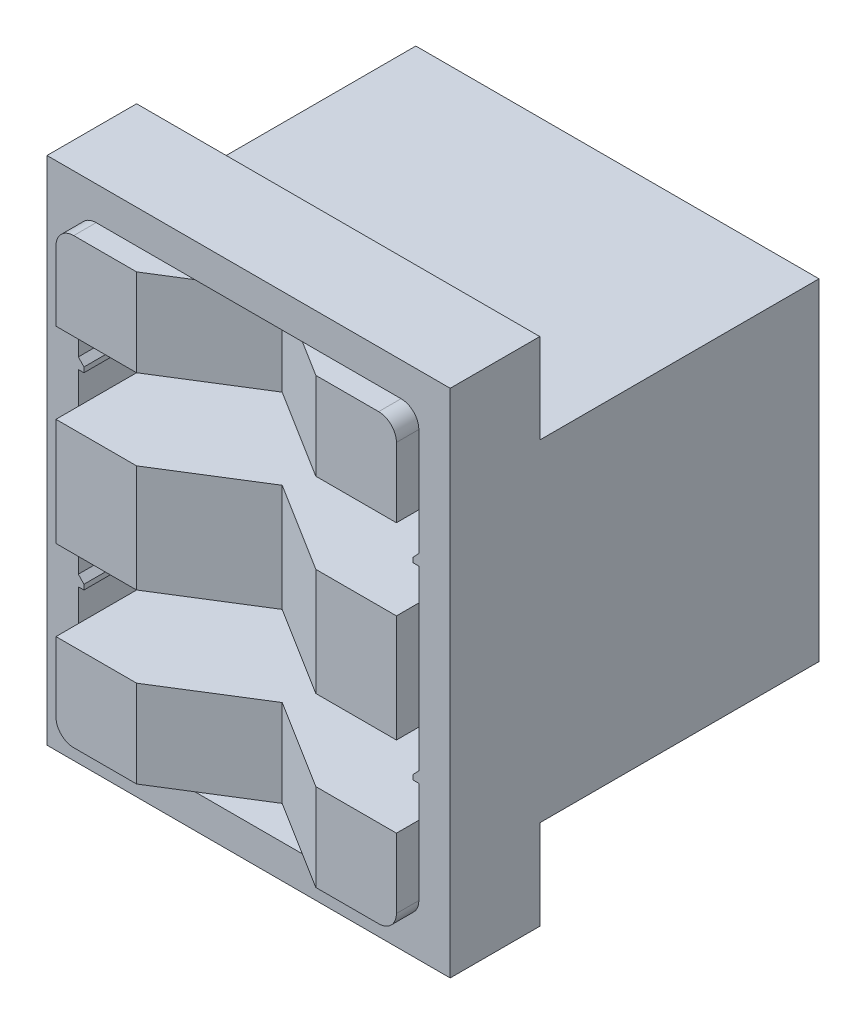
from build123d import *

# Parameters (mm, degrees)
SKETCH1_W            = 35.999968648
SKETCH1_H            = 39.60056603
BOSS_EXTRUDE1_DEPTH  = 33.93
SKETCH2_W            = 28.93
SKETCH2_H            = 5
CUT_EXTRUDE1_DEPTH   = 64.367558518
SKETCH3_W            = 16
SKETCH3_H            = 5
CUT_EXTRUDE2_DEPTH   = 64.367558518
CUT_EXTRUDE3_DEPTH   = 61.369212453
SKETCH5_W            = 30.4
SKETCH5_H            = 7.2
CUT_EXTRUDE4_DEPTH   = 31.93
CUT_EXTRUDE5_DEPTH   = 63.319559309
BOSS_EXTRUDE2_REACH  = 65.368
BOSS_EXTRUDE3_DEPTH  = 5
SKETCH16_W           = 35.999968648
SKETCH16_H           = 10
BOSS_EXTRUDE8_DEPTH  = 3
SKETCH12_W           = 35.999968648
SKETCH12_H           = 45.60056603
CUT_EXTRUDE6_DEPTH   = 2
FILLET1_R            = 1.5875
MOVE_START           = -34.93
MOVE_FACE1_OUTLINE_W = 35.999968648
MOVE_FACE1_OUTLINE_H = 29.60056603
MOVE_FACE1_DEPTH     = 1


# Read off the part's stored shape, not the designer's step: Move Face1
with BuildPart() as part:
    # Sketch1 → Boss-Extrude1 (new body)
    with BuildSketch(Plane.XY):
        with Locations((17.999984324, 19.800283015)):
            Rectangle(SKETCH1_W, SKETCH1_H)
    extrude(amount=-BOSS_EXTRUDE1_DEPTH)

    # Sketch2 → Cut-Extrude1 (cut, through all)
    with BuildSketch(Plane(origin=(35.999968648, 0, 0), x_dir=(0, 0, -1), z_dir=(1, 0, 0))):
        with Locations((19.465, 37.10056603)):
            Rectangle(SKETCH2_W, SKETCH2_H)
        with Locations((19.465, 2.5)):
            Rectangle(SKETCH2_W, SKETCH2_H)
    extrude(amount=-CUT_EXTRUDE1_DEPTH, mode=Mode.SUBTRACT)

    # Sketch3 → Cut-Extrude2 (cut, through all)
    with BuildSketch(Plane.XY):
        with Locations((17.999984324, 37.10056603)):
            Rectangle(SKETCH3_W, SKETCH3_H)
        with Locations((17.999984324, 2.5)):
            Rectangle(SKETCH3_W, SKETCH3_H)
    extrude(amount=-CUT_EXTRUDE2_DEPTH, mode=Mode.SUBTRACT)

    # Sketch4 → Cut-Extrude3 (cut, through all)
    with BuildSketch(Plane(origin=(0, 34.60056603, 0), x_dir=(1, 0, 0), z_dir=(0, 1, 0))):
        Polygon((9.999984324, 0), (17.999984324, 5), (25.999984324, 0), align=None)
    extrude(amount=-CUT_EXTRUDE3_DEPTH, mode=Mode.SUBTRACT)

    # Sketch5 → Cut-Extrude4 (cut)
    with BuildSketch(Plane.XY):
        with Locations((17.999984324, 11.4)):
            Rectangle(SKETCH5_W, SKETCH5_H)
        with Locations((17.999984324, 28.20056603)):
            Rectangle(SKETCH5_W, SKETCH5_H)
    extrude(amount=-CUT_EXTRUDE4_DEPTH, mode=Mode.SUBTRACT)

    # Sketch6 → Cut-Extrude5 (cut, through all)
    with BuildSketch(Plane.XY.offset(-31.93)):
        with BuildLine():
            Line((15.109984324, 29.66056603), (20.889984324, 29.66056603))
            ThreePointArc((20.889984324, 29.66056603), (22.469984324, 28.08056603), (20.889984324, 26.50056603))
            Line((20.889984324, 26.50056603), (15.109984324, 26.50056603))
            ThreePointArc((15.109984324, 26.50056603), (13.529984324, 28.08056603), (15.109984324, 29.66056603))
        make_face()
        with BuildLine():
            Line((15.109984324, 12.86), (20.889984324, 12.86))
            ThreePointArc((20.889984324, 12.86), (22.469984324, 11.28), (20.889984324, 9.7))
            Line((20.889984324, 9.7), (15.109984324, 9.7))
            ThreePointArc((15.109984324, 9.7), (13.529984324, 11.28), (15.109984324, 12.86))
        make_face()
    extrude(amount=-CUT_EXTRUDE5_DEPTH, mode=Mode.SUBTRACT)

    # Sketch7 → Boss-Extrude2 (add, up to next)
    with BuildSketch(Plane.XY, mode=Mode.PRIVATE) as boss_extrude2_sk1:
        Polygon((2.799984324, 28.422935376), (2.799984324, 27.45056603), (3.299984324, 27.45056603), (3.299984324, 27.896781183), align=None)
    boss_extrude2_tool1 = extrude(boss_extrude2_sk1.sketch, amount=-BOSS_EXTRUDE2_REACH, mode=Mode.PRIVATE) - part.part
    # Sketch7 → Boss-Extrude2 (add, up to next)
    with BuildSketch(Plane.XY, mode=Mode.PRIVATE) as boss_extrude2_sk2:
        Polygon((2.799984324, 11.622369346), (2.799984324, 10.65), (3.299984324, 10.65), (3.299984324, 11.096215154), align=None)
    boss_extrude2_tool2 = extrude(boss_extrude2_sk2.sketch, amount=-BOSS_EXTRUDE2_REACH, mode=Mode.PRIVATE) - part.part
    boss_extrude2_1 = boss_extrude2_tool1.solids().sort_by_distance((3.019076, 27.821475, 0))[0]
    add(boss_extrude2_1)
    boss_extrude2_2 = boss_extrude2_tool2.solids().sort_by_distance((3.019076, 11.020909, 0))[0]
    add(boss_extrude2_2)
    boss_extrude2 = boss_extrude2_1 + boss_extrude2_2  # Boss-Extrude2 as one shape, for the pattern or mirror that repeats it

    # Mirror1: Boss-Extrude2 across plane
    add(boss_extrude2.mirror(Plane(origin=(17.999984324, 0, 0), x_dir=(0, 0, 1), z_dir=(1, 0, 0))))

    # Sketch8 → Boss-Extrude3 (add)
    with BuildSketch(Plane(origin=(0, 34.60056603, 0), x_dir=(1, 0, 0), z_dir=(0, 1, 0))):
        Polygon((9.999984324, 0), (17.999984324, 5), (25.999984324, 0), (35.999968648, 0), (35.999968648, 10), (0, 10), (0, 0), align=None)
    boss_extrude3 = extrude(amount=BOSS_EXTRUDE3_DEPTH)

    # Sketch16 → Boss-Extrude8 (add)
    with BuildSketch(Plane(origin=(0, 39.60056603, 0), x_dir=(1, 0, 0), z_dir=(0, 1, 0))):
        with Locations((17.999984324, 5)):
            Rectangle(SKETCH16_W, SKETCH16_H)
    boss_extrude8 = extrude(amount=BOSS_EXTRUDE8_DEPTH)

    # Mirror2: Boss-Extrude3, Boss-Extrude8 across plane
    add(boss_extrude3.mirror(Plane.ZX.offset(19.800283015)))
    add(boss_extrude8.mirror(Plane.ZX.offset(19.800283015)))

    # Sketch12 → Cut-Extrude6 (cut)
    with BuildSketch(Plane.XY):
        with Locations((17.999984324, 19.800283015)):
            Rectangle(SKETCH12_W, SKETCH12_H)
        Polygon((2.799984324, 39.600283015), (33.199984324, 39.600283015), (33.199984324, 28.422935376), (32.699984324, 27.896781183), (32.699984324, 27.45056603), (33.199984324, 27.45056603), (33.199984324, 11.622369346), (32.699984324, 11.096215154), (32.699984324, 10.65), (33.199984324, 10.65), (33.199984324, 0.000283015), (2.799984324, 0.000283015), (2.799984324, 10.65), (3.299984324, 10.65), (3.299984324, 11.096215154), (2.799984324, 11.622369346), (2.799984324, 27.45056603), (3.299984324, 27.45056603), (3.299984324, 27.896781183), (2.799984324, 28.422935376), align=None, mode=Mode.SUBTRACT)
    extrude(amount=-CUT_EXTRUDE6_DEPTH, mode=Mode.SUBTRACT)

    # Fillet1
    fillet1_edges = [part.edges().sort_by_distance(p)[0] for p in [
        (33.199984324, 39.600283015, -1),
        (2.799984324, 0.000283015, -1),
        (2.799984324, 39.600283015, -1),
        (33.199984324, 0.000283015, -1),
    ]]
    fillet(fillet1_edges, radius=FILLET1_R)

    # Move Face1 outline → Move Face1 (add)
    with BuildSketch(Plane.XY.offset(MOVE_START)):
        with Locations((17.999984324, 19.800283015)):
            Rectangle(MOVE_FACE1_OUTLINE_W, MOVE_FACE1_OUTLINE_H)
        with BuildLine():
            ThreePointArc((15.109984324, 9.7), (13.529984324, 11.28), (15.109984324, 12.86))
            Line((15.109984324, 12.86), (20.889984324, 12.86))
            ThreePointArc((20.889984324, 12.86), (22.469984324, 11.28), (20.889984324, 9.7))
            Line((20.889984324, 9.7), (15.109984324, 9.7))
        make_face(mode=Mode.SUBTRACT)
        with BuildLine():
            ThreePointArc((15.109984324, 26.50056603), (13.529984324, 28.08056603), (15.109984324, 29.66056603))
            Line((15.109984324, 29.66056603), (20.889984324, 29.66056603))
            ThreePointArc((20.889984324, 29.66056603), (22.469984324, 28.08056603), (20.889984324, 26.50056603))
            Line((20.889984324, 26.50056603), (15.109984324, 26.50056603))
        make_face(mode=Mode.SUBTRACT)
    extrude(amount=MOVE_FACE1_DEPTH)


solid = part.part
